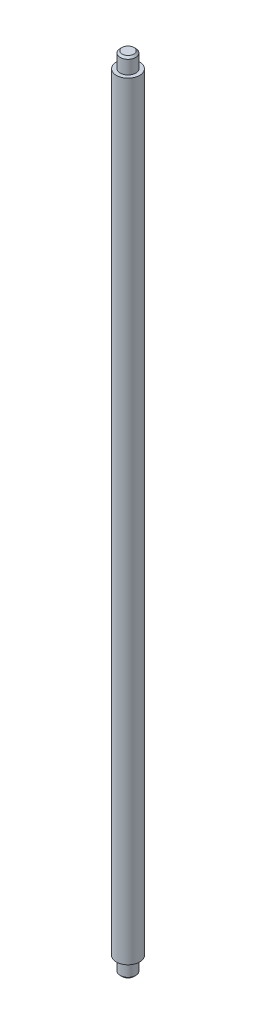
from build123d import *

# Parameters (mm, degrees)
IZIM1_R                     = 3
Y_KSEKLIK_EKSTR_ZYON6_DEPTH = 99
IZIM2_R                     = 2
Y_KSEKLIK_EKSTR_ZYON7_DEPTH = 4
RADYUS1_SIZE                = 0.5
Y_KSEKLIK_EKSTR_ZYON8_START = 4
IZIM5_R                     = 2
Y_KSEKLIK_EKSTR_ZYON8_DEPTH = 4
RADYUS2_SIZE                = 0.5


with BuildPart() as part:
    # Çizim1 → Yükseklik-Ekstrüzyon6 (new, symmetric)
    with BuildSketch(Plane(origin=(0, 0, 0), x_dir=(1, 0, 0), z_dir=(0, 1, 0))):
        with Locations(Location((0, 0, 0), (0, 0, 270))):
            Circle(IZIM1_R)
    extrude(amount=Y_KSEKLIK_EKSTR_ZYON6_DEPTH, both=True)

    # Çizim2 → Yükseklik-Ekstrüzyon7 (add)
    with BuildSketch(Plane(origin=(0, 99, 0), x_dir=(1, 0, 0), z_dir=(0, 1, 0))):
        with Locations(Location((0, 0, 0), (0, 0, 270))):
            Circle(IZIM2_R)
    extrude(amount=Y_KSEKLIK_EKSTR_ZYON7_DEPTH)

    # Radyus1
    # a fillet whose section is not a circle: 0.5 mm, written as the material it takes off along each edge
    with BuildSketch(Plane(origin=(0, 103, 0), x_dir=(0, 0, 1), z_dir=(-1, 0, 0))) as radyus1_piece_1:
        with BuildLine():
            Bezier((2, -RADYUS1_SIZE), (2, 0), (2 - RADYUS1_SIZE, 0), weights=[1, 0.035355339, 1])
            Line((2 - RADYUS1_SIZE, 0), (2, 0))
            Line((2, 0), (2, -RADYUS1_SIZE))
        make_face()
    revolve(axis=Axis((0, 103, 0), (0, 1, 0)), mode=Mode.SUBTRACT)

    # Çizim5 → Yükseklik-Ekstrüzyon8 (add)
    with BuildSketch(Plane.XZ.offset(99).offset(Y_KSEKLIK_EKSTR_ZYON8_START)):
        with Locations(Location((0, 0, 0), (0, 0, 90))):
            Circle(IZIM5_R)
    extrude(amount=-Y_KSEKLIK_EKSTR_ZYON8_DEPTH)

    # Radyus2
    # a fillet whose section is not a circle: 0.5 mm, written as the material it takes off along each edge
    with BuildSketch(Plane(origin=(0, -103, 0), x_dir=(0, 0, 1), z_dir=(1, 0, 0))) as radyus2_piece_1:
        with BuildLine():
            Bezier((2, -RADYUS2_SIZE), (2, 0), (2 - RADYUS2_SIZE, 0), weights=[1, 0.035355339, 1])
            Line((2 - RADYUS2_SIZE, 0), (2, 0))
            Line((2, 0), (2, -RADYUS2_SIZE))
        make_face()
    revolve(axis=Axis((0, -103, 0), (0, -1, 0)), mode=Mode.SUBTRACT)


solid = part.part
